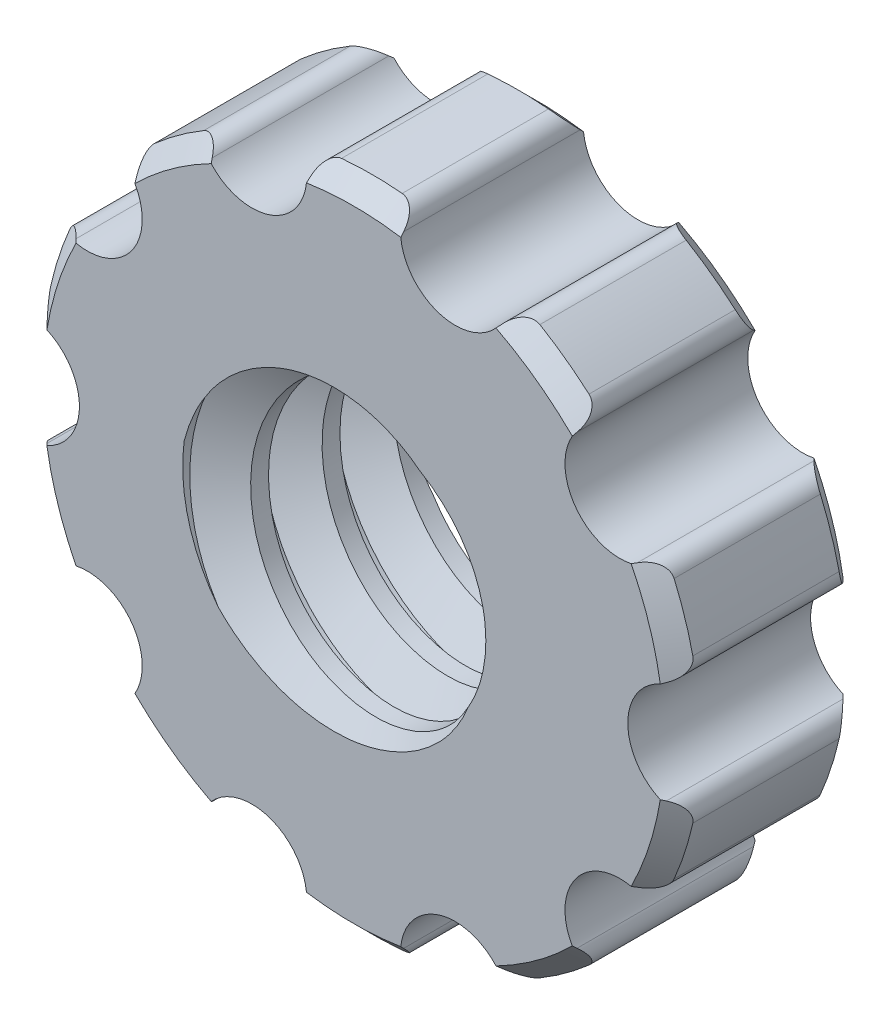
from build123d import *

# Parameters (mm, degrees)
SKETCH1_R                = 9
SKETCH1_R_2              = 4.675
BOSS_EXTRUDE1_DEPTH      = 5
THREAD1_PITCH            = 1.953846154
SKETCH4_R                = 9.464678692
CUT_EXTRUDE1_DEPTH       = 6
SKETCH5_R                = 9.464678692
CUT_EXTRUDE2_DEPTH       = 6
CHAMFER1_SIZE            = 0.5
SKETCH6_R                = 1.5
CUT_EXTRUDE3_DEPTH       = 14.674794368
FILLET1_R                = 0.5
CIRPATTERN1_COUNT        = 10
FILLET1_OF_CIRPATTERN1_R = 0.5


with BuildPart() as part:
    # Sketch1 → Boss-Extrude1 (new body)
    with BuildSketch(Plane.XY):
        Circle(SKETCH1_R)
        Circle(SKETCH1_R_2, mode=Mode.SUBTRACT)
    extrude(amount=BOSS_EXTRUDE1_DEPTH)

    # Thread1: the profile of Thread Profile1 profile screwed along a right-hand helix of 5.5 turns, 10 arcs to a turn; built about Z, then put on its axis
    thread1_z = Axis((0, 0, 0), (0, 0, 1))
    thread1_corners = [(4.6753, 0, -0.000173205), (4.6753, 0, 1.709788584), (3.617449752, 0, 1.099038459), (3.617449752, 0, 0.61057692)]
    with BuildLine(mode=Mode.PRIVATE) as thread1_profile:
        Line(thread1_corners[0], thread1_corners[1])
        Line(thread1_corners[1], thread1_corners[2])
        Line(thread1_corners[2], thread1_corners[3])
        Line(thread1_corners[3], thread1_corners[0])
    thread1_cap = Face(thread1_profile.wire())
    thread1_turn_angles = [0, 18, 36, 54, 72, 90, 108, 126, 144, 162, 180, 198, 216, 234, 252, 270, 288, 306, 324, 342, 360]
    thread1_turn_weights = [1, 0.9510565162951535, 1, 0.9510565162951535, 1, 0.9510565162951535, 1, 0.9510565162951535, 1, 0.9510565162951535, 1, 0.9510565162951535, 1, 0.9510565162951535, 1, 0.9510565162951535, 1, 0.9510565162951535, 1, 0.9510565162951535, 1]
    thread1_turn_rails = [Edge.make_bspline([Vector(p[0], p[1], 0).rotate(thread1_z, thread1_turn_angles[k]) / thread1_turn_weights[k] + Vector(0, 0, p[2] + THREAD1_PITCH * thread1_turn_angles[k] / 360) for k in range(21)], [0, 0, 0, 1, 1, 2, 2, 3, 3, 4, 4, 5, 5, 6, 6, 7, 7, 8, 8, 9, 9, 10, 10, 10], 2, thread1_turn_weights) for p in thread1_corners]
    thread1_turn_sides = [Face.make_surface_from_curves(thread1_turn_rails[p[0]], thread1_turn_rails[p[1]]) for p in [(0, 1), (1, 2), (2, 3), (3, 0)]]
    thread1_last_angles = [1800, 1818, 1836, 1854, 1872, 1890, 1908, 1926, 1944, 1962, 1980]
    thread1_last_weights = [1, 0.9510565162951535, 1, 0.9510565162951535, 1, 0.9510565162951535, 1, 0.9510565162951535, 1, 0.9510565162951535, 1]
    thread1_last_rails = [Edge.make_bspline([Vector(p[0], p[1], 0).rotate(thread1_z, thread1_last_angles[k]) / thread1_last_weights[k] + Vector(0, 0, p[2] + THREAD1_PITCH * thread1_last_angles[k] / 360) for k in range(11)], [0, 0, 0, 1, 1, 2, 2, 3, 3, 4, 4, 5, 5, 5], 2, thread1_last_weights) for p in thread1_corners]
    thread1_last_sides = [Face.make_surface_from_curves(thread1_last_rails[p[0]], thread1_last_rails[p[1]]) for p in [(0, 1), (1, 2), (2, 3), (3, 0)]]
    thread1 = Plane(origin=(0, 0, 6.75), x_dir=(-1, 0, 0), z_dir=(0, 0, -1)) * Solid(Shell([*[p.moved(Location((0, 0, THREAD1_PITCH * i))) for i in range(5) for p in thread1_turn_sides], *thread1_last_sides, thread1_cap, thread1_cap.rotate(thread1_z, 1980).moved(Location((0, 0, THREAD1_PITCH * 1980 / 360)))]))
    add(thread1)

    # Sketch4 → Cut-Extrude1 (cut)
    with BuildSketch(Plane(origin=(0, 0, 0), x_dir=(-1, 0, 0), z_dir=(0, 0, -1))):
        Circle(SKETCH4_R)
    extrude(amount=CUT_EXTRUDE1_DEPTH, mode=Mode.SUBTRACT)

    # Sketch5 → Cut-Extrude2 (cut)
    with BuildSketch(Plane.XY.offset(5)):
        Circle(SKETCH5_R)
    extrude(amount=CUT_EXTRUDE2_DEPTH, mode=Mode.SUBTRACT)

    # Chamfer1
    chamfer1_edges = [part.edges().sort_by_distance(p)[0] for p in [
        (-9, 0, 0),
        (-9, 0, 5),
    ]]
    chamfer(chamfer1_edges, length=CHAMFER1_SIZE)

    # Sketch6 → Cut-Extrude3 (cut, through all)
    with BuildSketch(Plane.XY.offset(5)):
        with Locations((-9, 0)):
            Circle(SKETCH6_R)
    cut_extrude3 = extrude(amount=-CUT_EXTRUDE3_DEPTH, mode=Mode.SUBTRACT)

    # Fillet1
    fillet1_edges = [part.edges().sort_by_distance(p)[0] for p in [
        (-8.875, 1.494782593, 2.5),
        (-8.875, -1.494782593, 2.5),
    ]]
    fillet(fillet1_edges, radius=FILLET1_R)

    # CirPattern1: Cut-Extrude3 ×10 about axis
    cirpattern1_axis = Axis((0, 0, 0), (0, 0, 1))
    for i in range(1, CIRPATTERN1_COUNT):
        add(cut_extrude3.rotate(cirpattern1_axis, i * 360 / CIRPATTERN1_COUNT), mode=Mode.SUBTRACT)

    # Fillet1 of CirPattern1
    fillet1_of_cirpattern1_edges = [part.edges().sort_by_distance(p)[0] for p in [
        (-8.058636989, -4.007289594, 2.5),
        (-6.301414662, -6.425898635, 2.5),
        (-4.16414855, -7.978713358, 2.5),
        (-1.3209031, -8.902539806, 2.5),
        (1.3209031, -8.902539806, 2.5),
        (4.16414855, -7.978713358, 2.5),
        (6.301414662, -6.425898635, 2.5),
        (8.058636989, -4.007289594, 2.5),
        (8.875, -1.494782593, 2.5),
        (8.875, 1.494782593, 2.5),
        (8.058636989, 4.007289594, 2.5),
        (6.301414662, 6.425898635, 2.5),
        (4.16414855, 7.978713358, 2.5),
        (1.3209031, 8.902539806, 2.5),
        (-1.3209031, 8.902539806, 2.5),
        (-4.16414855, 7.978713358, 2.5),
        (-6.301414662, 6.425898635, 2.5),
        (-8.058636989, 4.007289594, 2.5),
    ]]
    fillet(fillet1_of_cirpattern1_edges, radius=FILLET1_OF_CIRPATTERN1_R)


solid = part.part
